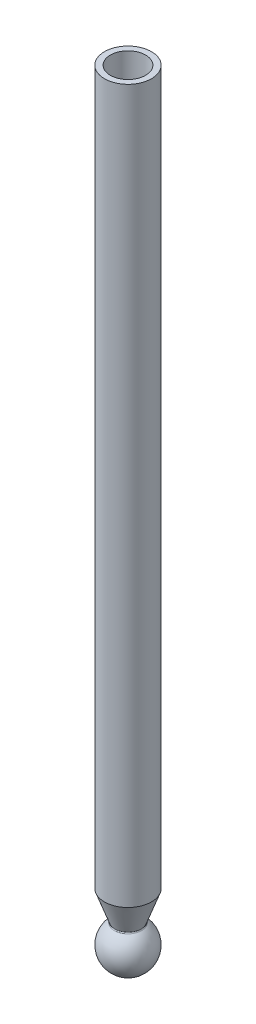
from build123d import *

# Parameters (mm, degrees)
SKETCH1_R           = 40
EXTRUDE1_DEPTH      = 1200
SKETCH2_R           = 30
CUT_EXTRUDE1_DEPTH  = 800
SKETCH_1_R          = 10
CUT_EXTRUDE_1_DEPTH = 35.6


# Read off the part's stored shape, not the designer's step: 连接重组1
with BuildPart() as part:
    # Sketch1 → Extrude1 (new body)
    with BuildSketch(Plane(origin=(0, 0, 0), x_dir=(1, 0, 0), z_dir=(0, 1, 0))):
        with Locations(Location((0, 0, 0), (0, 0, 270))):
            Circle(SKETCH1_R)
    extrude(amount=-EXTRUDE1_DEPTH)

    # Sketch2 → Cut-Extrude1 (cut)
    with BuildSketch(Plane(origin=(0, 0, 0), x_dir=(1, 0, 0), z_dir=(0, 1, 0))):
        with Locations(Location((0, 0, 0), (0, 0, 270))):
            Circle(SKETCH2_R)
    extrude(amount=-CUT_EXTRUDE1_DEPTH, mode=Mode.SUBTRACT)

    # 草图1 → 切除-拉伸1 (cut)
    with BuildSketch(Plane.XZ.offset(1200)):
        with Locations(Location((0, 0, 0), (0, 0, 270))):
            Circle(SKETCH_1_R)
    extrude(amount=-CUT_EXTRUDE_1_DEPTH, mode=Mode.SUBTRACT)

    # 连接重组1 outline → 连接重组1 (revolve)
    with BuildSketch(Plane.XY):
        with BuildLine():
            ThreePointArc((0, -1337.73332), (38.089361999, -1309.948085758), (23.262631735, -1265.193345126))
            ThreePointArc((23.262631735, -1265.193345126), (22.516451416, -1264.161768918), (22.543988515, -1262.888907458))
            Line((22.543988515, -1262.888907458), (39.999998202, -1214.399991661))
            Line((39.999998202, -1214.399991661), (40, -1200))
            Line((40, -1200), (10, -1200))
            Line((10, -1200), (10, -1164.4))
            Line((10, -1164.4), (0, -1164.4))
            Line((0, -1164.4), (0, -1337.73332))
        make_face()
    revolve(axis=Axis((0, 0, 0), (0, 1, 0)))


solid = part.part
